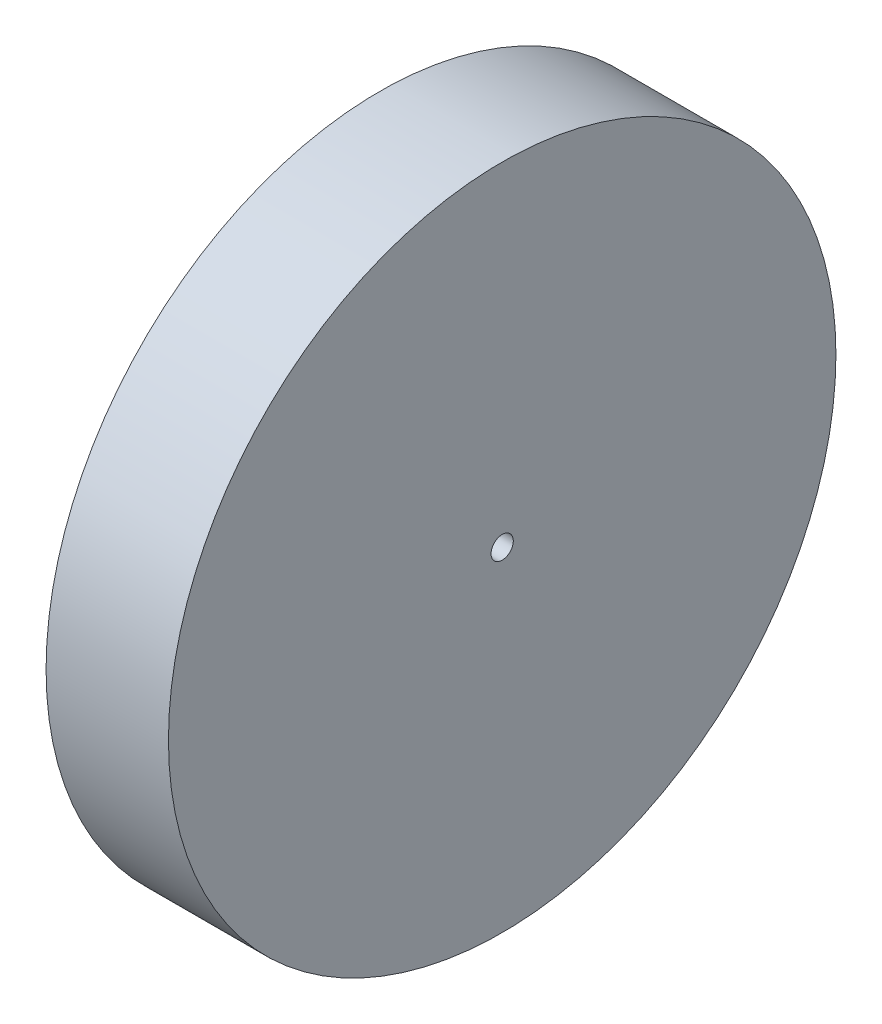
from build123d import *

# Parameters (mm, degrees)
BASPROSKE_W        = 12
BASPROSKE_H        = 12
TOOTHCUT_DEPTH     = 86.697141143
TEETHCUTS_COUNT    = 50
BOSS_EXTRU_1_START = 10
ESQUISSE1_R        = 60
ESQUISSE1_R_2      = 2
BOSS_EXTRU_1_DEPTH = 10


with BuildPart() as part:
    # BasProSke → Base-Revolve (revolve)
    with BuildSketch(Plane(origin=(0, 0, 0), x_dir=(1, 0, 0), z_dir=(0, 1, 0))):
        with Locations((6, 54)):
            Rectangle(BASPROSKE_W, BASPROSKE_H)
    revolve(axis=Axis((-10, 0, 0), (1, 0, 0)))

    # TooCutSke → ToothCut (cut, through all)
    with BuildSketch(Plane(origin=(0, 0, 0), x_dir=(0, 0, -1), z_dir=(1, 0, 0))):
        with BuildLine():
            ThreePointArc((2.426707814, 47.913185391), (1.628356337, 50.250450788), (0.603274723, 52.497533853))
            ThreePointArc((0.603274723, 52.497533853), (0, 52.501), (-0.603274723, 52.497533853))
            ThreePointArc((-0.603274723, 52.497533853), (-1.628356337, 50.250450788), (-2.426707814, 47.913185391))
            ThreePointArc((-2.426707814, 47.913185391), (0, 47.9746), (2.426707814, 47.913185391))
        make_face()
    toothcut = extrude(amount=TOOTHCUT_DEPTH, mode=Mode.SUBTRACT)

    # TeethCuts: ToothCut ×50 about axis
    teethcuts_axis = Axis((-10, 0, 0), (1, 0, 0))
    for i in range(1, TEETHCUTS_COUNT):
        add(toothcut.rotate(teethcuts_axis, i * 360 / TEETHCUTS_COUNT), mode=Mode.SUBTRACT)

    # Esquisse1 → Boss.-Extru.1 (add)
    with BuildSketch(Plane(origin=(12, 0, 0), x_dir=(0, 0, -1), z_dir=(1, 0, 0)).offset(BOSS_EXTRU_1_START)):
        Circle(ESQUISSE1_R)
        Circle(ESQUISSE1_R_2, mode=Mode.SUBTRACT)
    extrude(amount=-BOSS_EXTRU_1_DEPTH)


solid = part.part
